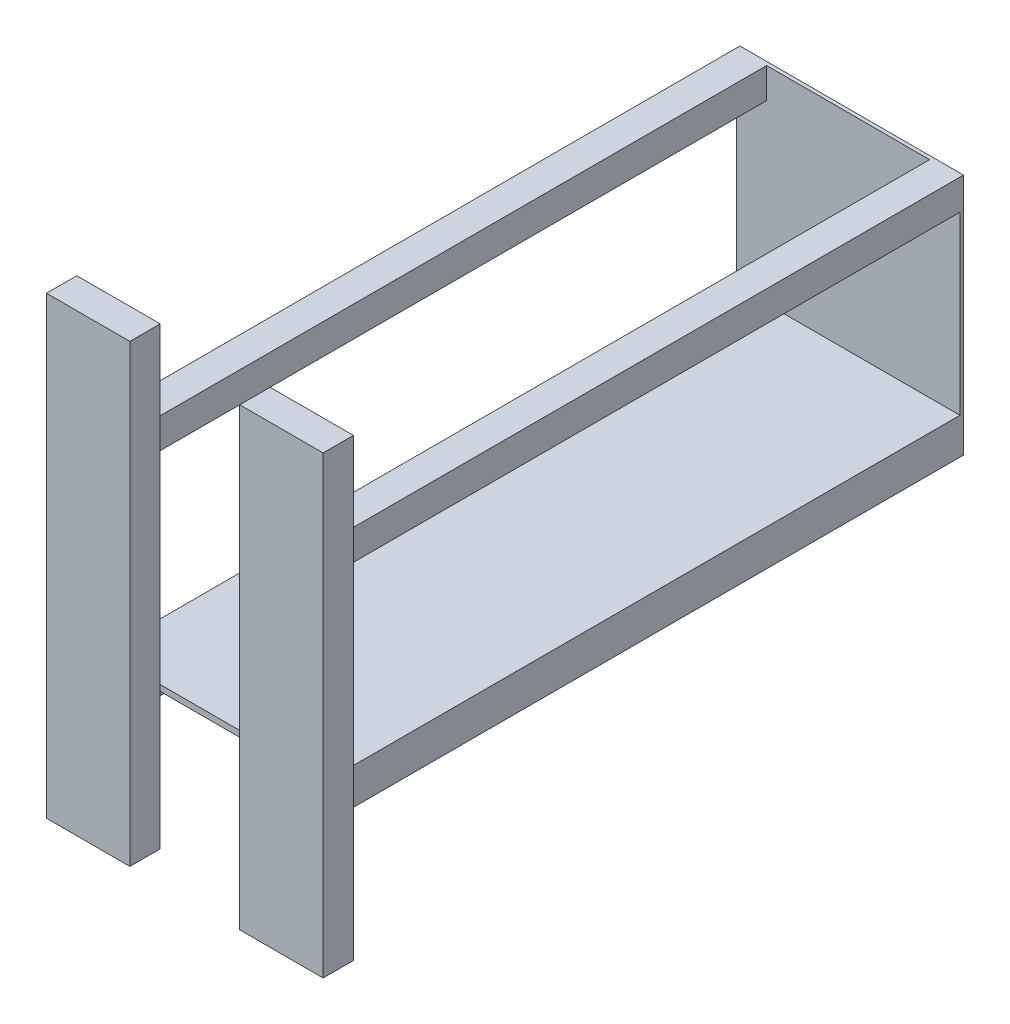
from build123d import *

# Parameters (mm, degrees)
SKETCH1_W           = 374.65
SKETCH1_H           = 406.4
BOSS_EXTRUDE1_DEPTH = 6
SKETCH1_5_W         = 50.8
SKETCH1_5_H         = 50.8
BOSS_EXTRUDE2_DEPTH = 1066.8
SKETCH3_W           = 139.7
SKETCH3_H           = 762
BOSS_EXTRUDE4_DEPTH = 50.8
SKETCH4_W           = 374.65
SKETCH4_H           = 1060.8
BOSS_EXTRUDE5_DEPTH = 10


with BuildPart() as part:
    # Sketch1 → Boss-Extrude1 (new body)
    with BuildSketch(Plane.XY):
        with Locations((187.325, 203.2)):
            Rectangle(SKETCH1_W, SKETCH1_H)
    extrude(amount=BOSS_EXTRUDE1_DEPTH)

    # Sketch1<5> → Boss-Extrude2 (add)
    with BuildSketch(Plane.XY):
        with Locations((25.4, 381)):
            Rectangle(SKETCH1_5_W, SKETCH1_5_H)
        with Locations((25.4, 25.4)):
            Rectangle(SKETCH1_5_W, SKETCH1_5_H)
        with Locations((349.25, 25.4)):
            Rectangle(SKETCH1_5_W, SKETCH1_5_H)
        with Locations((349.25, 381)):
            Rectangle(SKETCH1_5_W, SKETCH1_5_H)
    extrude(amount=BOSS_EXTRUDE2_DEPTH)

    # Sketch3 → Boss-Extrude4 (add)
    with BuildSketch(Plane.XY.offset(1066.8)):
        with Locations((25.4, 203.2)):
            Rectangle(SKETCH3_W, SKETCH3_H)
        with Locations((349.25, 203.2)):
            Rectangle(SKETCH3_W, SKETCH3_H)
    extrude(amount=BOSS_EXTRUDE4_DEPTH)

    # Sketch4 → Boss-Extrude5 (add)
    with BuildSketch(Plane(origin=(0, 50.8, 0), x_dir=(1, 0, 0), z_dir=(0, 1, 0))):
        with Locations((187.325, -536.4)):
            Rectangle(SKETCH4_W, SKETCH4_H)
    extrude(amount=BOSS_EXTRUDE5_DEPTH)


solid = part.part
